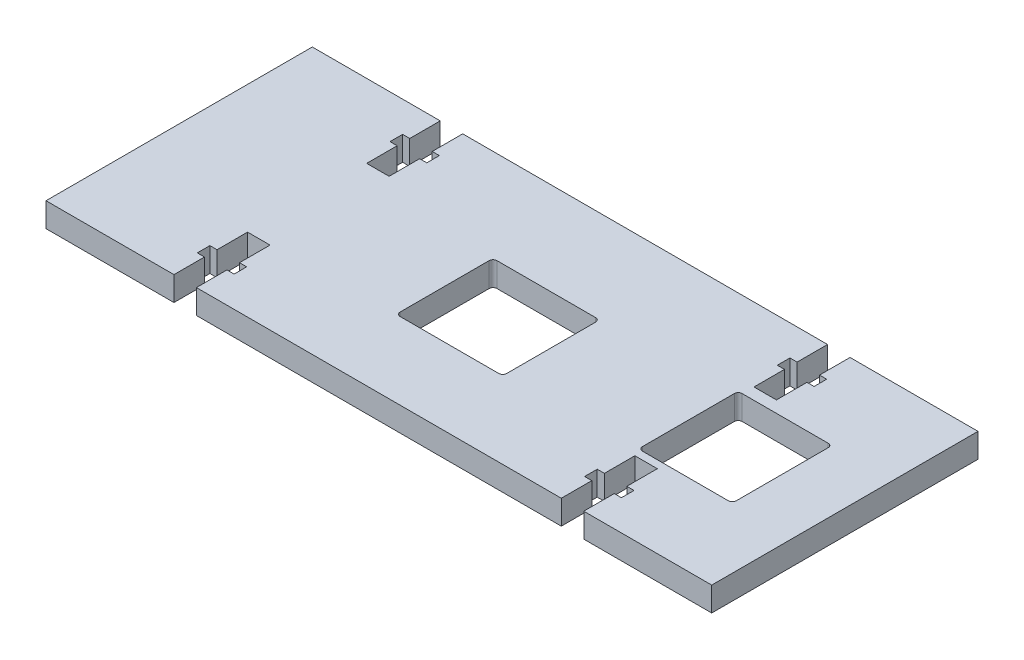
from build123d import *

# Parameters (mm, degrees)
SKETCH1_W           = 87.3125
SKETCH1_H           = 34.925
BOSS_EXTRUDE1_DEPTH = 3.175
CUT_EXTRUDE2_DEPTH  = 48.126295158
SKETCH4_W           = 13.97
SKETCH4_H           = 12.7
SKETCH4_W_2         = 12.30601469
SKETCH4_H_2         = 13.081
CUT_EXTRUDE3_DEPTH  = 48.126295158
FILLET1_R           = 0.508


with BuildPart() as part:
    # Sketch1 → Boss-Extrude1 (new body)
    with BuildSketch(Plane(origin=(0, 0, 0), x_dir=(1, 0, 0), z_dir=(0, 1, 0))):
        Rectangle(SKETCH1_W, SKETCH1_H)
    extrude(amount=BOSS_EXTRUDE1_DEPTH)

    # Sketch3 → Cut-Extrude2 (cut, through all)
    with BuildSketch(Plane.XZ):
        Polygon((-26.8732, 17.4625), (-23.9268, 17.4625), (-23.9268, 13.462), (-22.987, 13.462), (-22.987, 11.811), (-23.9268, 11.811), (-23.9268, 7.8105), (-26.8732, 7.8105), (-26.8732, 11.811), (-27.813, 11.811), (-27.813, 13.462), (-26.8732, 13.462), align=None)
        Polygon((26.8732, 11.811), (26.8732, 7.8105), (23.9268, 7.8105), (23.9268, 11.811), (22.987, 11.811), (22.987, 13.462), (23.9268, 13.462), (23.9268, 17.4625), (26.8732, 17.4625), (26.8732, 13.462), (27.813, 13.462), (27.813, 11.811), align=None)
        Polygon((26.8732, -17.4625), (23.9268, -17.4625), (23.9268, -13.462), (22.987, -13.462), (22.987, -11.811), (23.9268, -11.811), (23.9268, -7.8105), (26.8732, -7.8105), (26.8732, -11.811), (27.813, -11.811), (27.813, -13.462), (26.8732, -13.462), align=None)
        Polygon((-26.8732, -11.811), (-26.8732, -7.8105), (-23.9268, -7.8105), (-23.9268, -11.811), (-22.987, -11.811), (-22.987, -13.462), (-23.9268, -13.462), (-23.9268, -17.4625), (-26.8732, -17.4625), (-26.8732, -13.462), (-27.813, -13.462), (-27.813, -11.811), align=None)
    extrude(amount=-CUT_EXTRUDE2_DEPTH, mode=Mode.SUBTRACT)

    # Sketch4 → Cut-Extrude3 (cut, through all)
    with BuildSketch(Plane(origin=(0, 0, 0), x_dir=(-1, 0, 0), z_dir=(0, -1, 0))):
        with Locations((0.8075, -1.0435)):
            Rectangle(SKETCH4_W, SKETCH4_H)
        with Locations((-29.5375, -0.254)):
            Rectangle(SKETCH4_W_2, SKETCH4_H_2)
    extrude(amount=-CUT_EXTRUDE3_DEPTH, mode=Mode.SUBTRACT)

    # Fillet1
    fillet1_edges = [part.edges().sort_by_distance(p)[0] for p in [
        (35.690507345, 1.5875, -6.2865),
        (23.384492655, 1.5875, -6.2865),
        (-7.7925, 1.5875, -5.3065),
        (6.1775, 1.5875, -5.3065),
        (6.1775, 1.5875, 7.3935),
        (-7.7925, 1.5875, 7.3935),
        (35.690507345, 1.5875, 6.7945),
        (23.384492655, 1.5875, 6.7945),
    ]]
    fillet(fillet1_edges, radius=FILLET1_R)


solid = part.part
